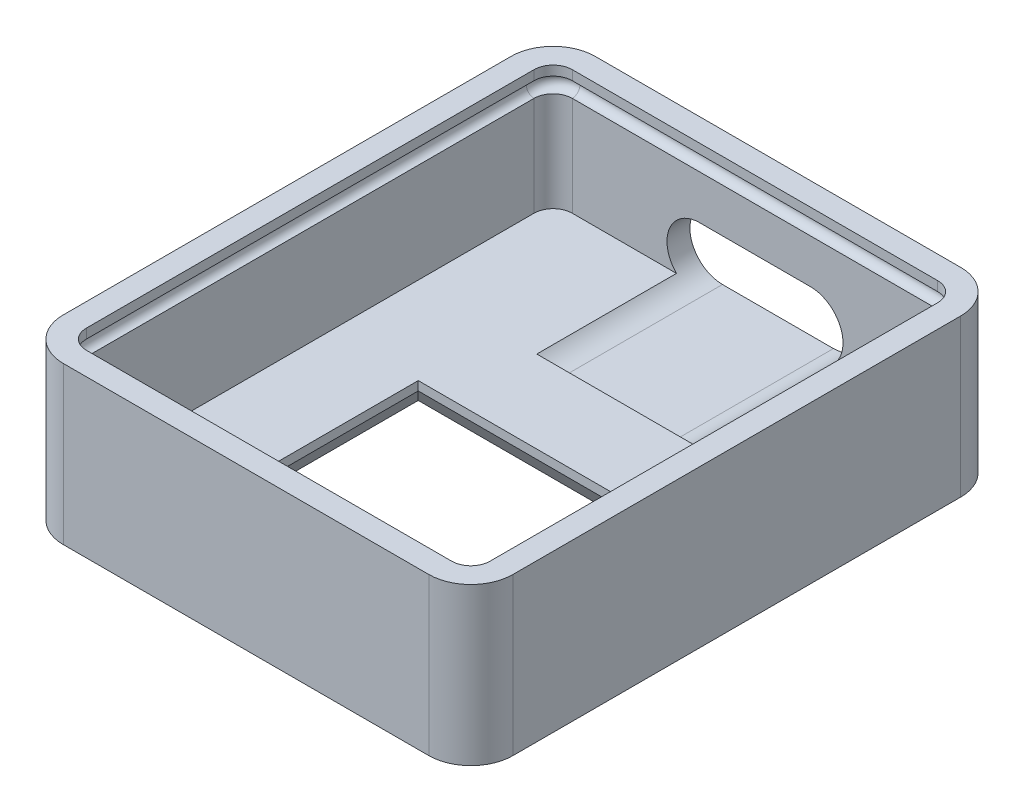
from build123d import *

# Parameters (mm, degrees)
BOSS_EXTRUDE7_DEPTH     = 6.5
BOSS_EXTRUDE8_START     = 1.7
BOSS_EXTRUDE8_DEPTH     = 1.7
CUT_EXTRUDE1_DEPTH      = 8.5
SKETCH6_W               = 12
SKETCH6_H               = 7.5
CUT_EXTRUDE2_DEPTH      = 8.5
CHAMFER1_SIZE           = 0.8
CHAMFER1_SIZE2          = 1.231891971
SKETCH7_R               = 0.4
CUT_EXTRUDE3_DEPTH      = 2
CUT_EXTRUDE3_DEPTH_BACK = 36.03740858
CHAMFER2_SIZE           = 0.5
CUT_EXTRUDE4_REACH      = 34.411
SKETCH12_R              = 0.8
BOSS_EXTRUDE9_DEPTH     = 0.5
CHAMFER3_SIZE           = 0.5


# Some blends are built 0.0001 mm under size
with BuildPart() as part:
    # Sketch1 → Boss-Extrude7 (new body)
    with BuildSketch(Plane(origin=(0, 0, 0), x_dir=(1, 0, 0), z_dir=(0, 1, 0))):
        with BuildLine():
            Line((0.8, 26.4), (19.9, 26.4))
            ThreePointArc((19.9, 26.4), (21.455634919, 25.755634919), (22.1, 24.2))
            Line((22.1, 24.2), (22.1, 0.8))
            ThreePointArc((22.1, 0.8), (21.455634919, -0.755634919), (19.9, -1.4))
            Line((19.9, -1.4), (0.8, -1.4))
            ThreePointArc((0.8, -1.4), (-0.755634919, -0.755634919), (-1.4, 0.8))
            Line((-1.4, 0.8), (-1.4, 24.2))
            ThreePointArc((-1.4, 24.2), (-0.755634919, 25.755634919), (0.8, 26.4))
        make_face()
        with BuildLine():
            Line((0.8, 25.2), (19.9, 25.2))
            ThreePointArc((19.9, 25.2), (20.607106781, 24.907106781), (20.9, 24.2))
            Line((20.9, 24.2), (20.9, 0.8))
            ThreePointArc((20.9, 0.8), (20.607106781, 0.092893219), (19.9, -0.2))
            Line((19.9, -0.2), (0.8, -0.2))
            ThreePointArc((0.8, -0.2), (0.092893219, 0.092893219), (-0.2, 0.8))
            Line((-0.2, 0.8), (-0.2, 24.2))
            ThreePointArc((-0.2, 24.2), (0.092893219, 24.907106781), (0.8, 25.2))
        make_face(mode=Mode.SUBTRACT)
    extrude(amount=BOSS_EXTRUDE7_DEPTH)

    # Sketch4 → Boss-Extrude8 (add)
    with BuildSketch(Plane.XZ.offset(BOSS_EXTRUDE8_START)):
        with BuildLine():
            Line((0.8, -26.4), (19.9, -26.4))
            ThreePointArc((19.9, -26.4), (21.455634919, -25.755634919), (22.1, -24.2))
            Line((22.1, -24.2), (22.1, -0.8))
            ThreePointArc((22.1, -0.8), (21.455634919, 0.755634919), (19.9, 1.4))
            Line((19.9, 1.4), (0.8, 1.4))
            ThreePointArc((0.8, 1.4), (-0.755634919, 0.755634919), (-1.4, -0.8))
            Line((-1.4, -0.8), (-1.4, -24.2))
            ThreePointArc((-1.4, -24.2), (-0.755634919, -25.755634919), (0.8, -26.4))
        make_face()
    extrude(amount=-BOSS_EXTRUDE8_DEPTH)

    # Sketch5 → Cut-Extrude1 (cut)
    with BuildSketch(Plane(origin=(0, 0, -26.4), x_dir=(-1, 0, 0), z_dir=(0, 0, -1))):
        with BuildLine():
            Line((-13.25, 2.9), (-7.45, 2.9))
            ThreePointArc((-7.45, 2.9), (-5.75, 1.2), (-7.45, -0.5))
            Line((-7.45, -0.5), (-13.25, -0.5))
            ThreePointArc((-13.25, -0.5), (-14.95, 1.2), (-13.25, 2.9))
        make_face()
    extrude(amount=-CUT_EXTRUDE1_DEPTH, mode=Mode.SUBTRACT)

    # Sketch6 → Cut-Extrude2 (cut)
    with BuildSketch(Plane(origin=(0, 0, 0), x_dir=(1, 0, 0), z_dir=(0, 1, 0))):
        with Locations((10.35, 9.85)):
            Rectangle(SKETCH6_W, SKETCH6_H)
    extrude(amount=-CUT_EXTRUDE2_DEPTH, mode=Mode.SUBTRACT)

    # Chamfer1
    chamfer1_edges = [part.edges().sort_by_distance(p)[0] for p in [
        (10.35, -1.7, -6.1),
        (16.35, -1.7, -9.85),
        (10.35, -1.7, -13.6),
        (4.35, -1.7, -9.85),
    ]]
    chamfer1_side = [part.faces().sort_by_distance(p)[0] for p in [
        (-0.498235424, -1.7, -25.498235424),
    ]]
    chamfer(chamfer1_edges, length=CHAMFER1_SIZE, length2=CHAMFER1_SIZE2, reference=chamfer1_side[0])

    # Cut-Sweep1: sweep along a path in Sketch9
    with BuildLine(Plane(origin=(0, 6.5, 0), x_dir=(1, 0, 0), z_dir=(0, 1, 0))) as cut_sweep1_path:
        Line((-1.4, 24.2), (-1.4, 0.8))
        ThreePointArc((-1.4, 0.8), (-0.755634919, -0.755634919), (0.8, -1.4))
        Line((0.8, -1.4), (19.9, -1.4))
        ThreePointArc((19.9, -1.4), (21.455634919, -0.755634919), (22.1, 0.8))
        Line((22.1, 0.8), (22.1, 24.2))
        ThreePointArc((22.1, 24.2), (21.455634919, 25.755634919), (19.9, 26.4))
        Line((19.9, 26.4), (0.8, 26.4))
        ThreePointArc((0.8, 26.4), (-0.755634919, 25.755634919), (-1.4, 24.2))
    # Sketch7 → Cut-Sweep1 (sweep, cut)
    with BuildSketch(Plane(origin=(0, 0, -16.4), x_dir=(-1, 0, 0), z_dir=(0, 0, -1))):
        with Locations((-20.9, 5.6)):
            Circle(SKETCH7_R)
    sweep(path=cut_sweep1_path.line, mode=Mode.SUBTRACT)

    # Sketch10 → Cut-Extrude3 (cut, two sides: drawn at the far end of the back side and taken through both)
    with BuildSketch(Plane(origin=(0, 0, 0), x_dir=(1, 0, 0), z_dir=(0, 1, 0)).offset(-CUT_EXTRUDE3_DEPTH_BACK)):
        with BuildLine():
            Line((15.905695732, 4), (13.405695732, 4))
            Line((13.405695732, 4), (13.405695732, 3.6))
            Line((13.405695732, 3.6), (15.905695732, 3.6))
            ThreePointArc((15.905695732, 3.6), (17.705695732, 1.8), (15.905695732, 0))
            Line((15.905695732, 0), (13.405695732, 0))
            Line((13.405695732, 0), (13.405695732, -0.4))
            Line((13.405695732, -0.4), (15.905695732, -0.4))
            ThreePointArc((15.905695732, -0.4), (18.105695732, 1.8), (15.905695732, 4))
        make_face()
    extrude(amount=CUT_EXTRUDE3_DEPTH + CUT_EXTRUDE3_DEPTH_BACK, mode=Mode.SUBTRACT)

    # Chamfer2
    # the kernel refuses this chamfer: 0.5 mm, written as the material it adds along each edge
    with BuildSketch(Plane(origin=(15.905695732, 2, -1.8), x_dir=(0, 0, 1), z_dir=(-1, 0, 0))) as chamfer2_piece_1_section:
        Polygon((2.2, -CHAMFER2_SIZE), (2.2 - CHAMFER2_SIZE, 0), (2.2, 0), align=None)
    chamfer2_piece_1 = revolve(axis=Axis((15.905695732, 2, -1.8), (0, 1, 0)), revolution_arc=58.108843161, mode=Mode.PRIVATE)
    chamfer2_piece_1 = split(chamfer2_piece_1, bisect_by=Plane(origin=(16.26277058, 1.786381102, 0.2), z_dir=(0, 0, 1)), keep=Keep.TOP, mode=Mode.PRIVATE)
    add(chamfer2_piece_1)
    with BuildSketch(Plane(origin=(12.119854238, 2, 0.4), x_dir=(0, -0.9996219169112968, 0.02749587661058638), z_dir=(1, 0, 0))) as chamfer2_piece_2_section:
        Polygon((CHAMFER2_SIZE * 0.999621916911, CHAMFER2_SIZE * 0.0274958766106), (-CHAMFER2_SIZE * 0.0274958766106, CHAMFER2_SIZE * 0.999621916911), (0, 0), align=None)
    chamfer2_piece_2 = extrude(amount=3.785841494, mode=Mode.PRIVATE)
    chamfer2_piece_2 = split(chamfer2_piece_2, bisect_by=Plane(origin=(14.374950242, 1.792648103, 0.2), z_dir=(0, 0, 1)), keep=Keep.TOP, mode=Mode.PRIVATE)
    add(chamfer2_piece_2)

    # Sketch11 → Cut-Extrude4 (cut, up to next)
    with BuildSketch(Plane(origin=(0, 0, -3.6), x_dir=(-1, 0, 0), z_dir=(0, 0, -1)), mode=Mode.PRIVATE) as cut_extrude4_sk1:
        Polygon((-13.405695732, 0), (-13.405695732, -1.1), (-14.505695732, 0), align=None)
    cut_extrude4_tool1 = extrude(cut_extrude4_sk1.sketch, amount=-CUT_EXTRUDE4_REACH, mode=Mode.PRIVATE) & part.part
    add(cut_extrude4_tool1.solids().sort_by_distance((13.772362, -0.366667, -3.6))[0], mode=Mode.SUBTRACT)

    # Sketch12 → Boss-Extrude9 (add)
    with BuildSketch(Plane(origin=(0, 0, 0), x_dir=(1, 0, 0), z_dir=(0, 1, 0))):
        with Locations(Location((15.905695732, 1.8, 0), (0, 0, 270))):
            Circle(SKETCH12_R)
    extrude(amount=BOSS_EXTRUDE9_DEPTH)

    # Chamfer3
    chamfer3_edges = [part.edges().sort_by_distance(p)[0] for p in [
        (15.905695732, 0, -2.6),
    ]]
    chamfer(chamfer3_edges, length=CHAMFER3_SIZE - 0.0001)  # a hair under: the kernel refuses the full size


solid = part.part
